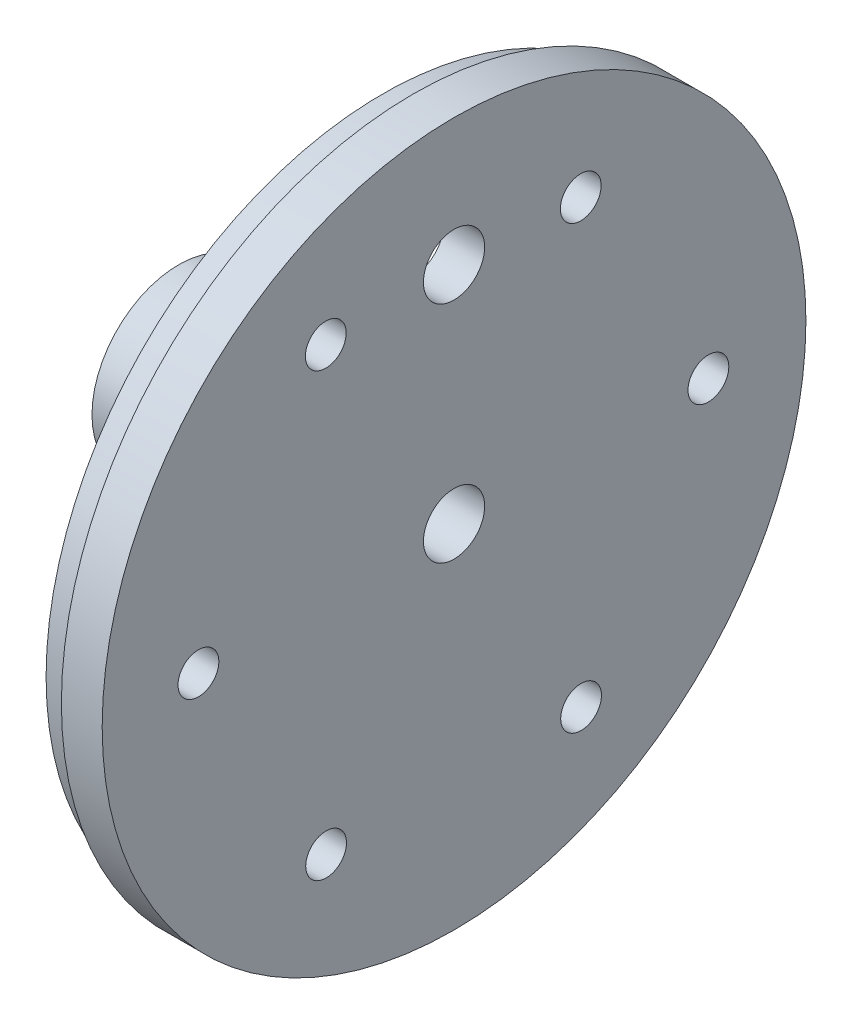
from build123d import *

# Parameters (mm, degrees)
SKETCH1_R           = 34.5
BOSS_EXTRUDE1_DEPTH = 2
SKETCH2_R           = 8.5
BOSS_EXTRUDE2_DEPTH = 23
SKETCH4_R           = 3
CUT_EXTRUDE1_DEPTH  = 30
CUT_EXTRUDE2_REACH  = 62.533
SKETCH5_R           = 1.5
CUT_EXTRUDE3_REACH  = 56.822
SKETCH6_R           = 1.5
SKETCH19_R          = 33
SKETCH19_R_2        = 30
BOSS_EXTRUDE5_DEPTH = 3
SKETCH21_R          = 3
CUT_EXTRUDE6_DEPTH  = 10
SKETCH20_R          = 2
CUT_EXTRUDE7_DEPTH  = 10


with BuildPart() as part:
    # Sketch1 → Boss-Extrude1 (new, symmetric)
    with BuildSketch(Plane(origin=(0, 0, 0), x_dir=(0, 0, -1), z_dir=(1, 0, 0))):
        Circle(SKETCH1_R)
    extrude(amount=BOSS_EXTRUDE1_DEPTH, both=True)

    # Sketch2 → Boss-Extrude2 (add)
    with BuildSketch(Plane.ZY.offset(2)):
        Circle(SKETCH2_R)
    extrude(amount=BOSS_EXTRUDE2_DEPTH)

    # Sketch4 → Cut-Extrude1 (cut)
    with BuildSketch(Plane.ZY.offset(25)):
        Circle(SKETCH4_R)
    extrude(amount=-CUT_EXTRUDE1_DEPTH, mode=Mode.SUBTRACT)

    # Sketch5 → Cut-Extrude2 (cut, up to next)
    with BuildSketch(Plane(origin=(0, 8.5, 0), x_dir=(1, 0, 0), z_dir=(0, 1, 0)), mode=Mode.PRIVATE) as cut_extrude2_sk1:
        with Locations((-19.5, 0)):
            Circle(SKETCH5_R)
    cut_extrude2_tool1 = extrude(cut_extrude2_sk1.sketch, amount=-CUT_EXTRUDE2_REACH, mode=Mode.PRIVATE) & part.part
    add(cut_extrude2_tool1.solids().sort_by_distance((-19.5, 8.5, 0))[0], mode=Mode.SUBTRACT)

    # Sketch6 → Cut-Extrude3 (cut, up to next)
    with BuildSketch(Plane.XY, mode=Mode.PRIVATE) as cut_extrude3_sk1:
        with Locations((-19.5, 0)):
            Circle(SKETCH6_R)
    cut_extrude3_tool1 = extrude(cut_extrude3_sk1.sketch, amount=-CUT_EXTRUDE3_REACH, mode=Mode.PRIVATE) & part.part
    add(cut_extrude3_tool1.solids().sort_by_distance((-19.5, 0, 0))[0], mode=Mode.SUBTRACT)

    # Sketch19 → Boss-Extrude5 (add)
    with BuildSketch(Plane.ZY.offset(2)):
        Circle(SKETCH19_R)
        Circle(SKETCH19_R_2, mode=Mode.SUBTRACT)
    extrude(amount=BOSS_EXTRUDE5_DEPTH)

    # Sketch21 → Cut-Extrude6 (cut)
    with BuildSketch(Plane.ZY.offset(2)):
        with Locations((0, 22)):
            Circle(SKETCH21_R)
    extrude(amount=-CUT_EXTRUDE6_DEPTH, mode=Mode.SUBTRACT)

    # Sketch20 → Cut-Extrude7 (cut)
    with BuildSketch(Plane.ZY.offset(2)):
        with Locations((-12.422389037, 21.516208963)):
            Circle(SKETCH20_R)
        with Locations((12.577603677, 21.497122149)):
            Circle(SKETCH20_R)
        with Locations((25.061070367, -0.163050043)):
            Circle(SKETCH20_R)
        with Locations((12.544544344, -21.804135421)):
            Circle(SKETCH20_R)
        with Locations((-12.45544837, -21.785048606)):
            Circle(SKETCH20_R)
        with Locations((-24.93891506, -0.124876414)):
            Circle(SKETCH20_R)
    extrude(amount=-CUT_EXTRUDE7_DEPTH, mode=Mode.SUBTRACT)


solid = part.part
